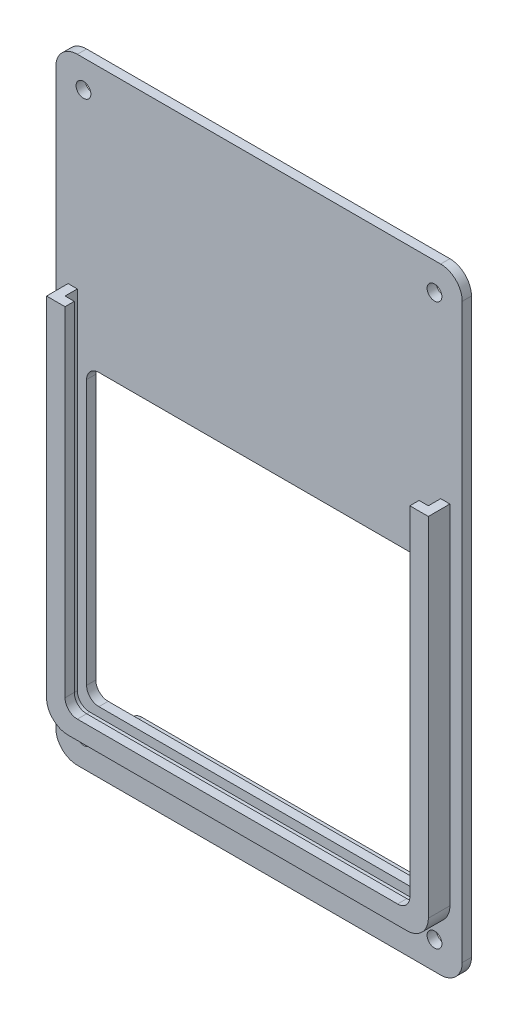
from build123d import *

# Parameters (mm, degrees)
SKETCH_1_W          = 66
SKETCH_1_H          = 100
EXTRUDE_1_DEPTH     = 1.5
FILLET_1_R          = 3.5
SKETCH_2_W          = 56
SKETCH_2_H          = 47
CUT_EXTRUDE_1_DEPTH = 1.5
FILLET_2_R          = 2
EXTRUDE_2_DEPTH     = 2
FILLET_3_R          = 2
EXTRUDE_3_DEPTH     = 1.5
FILLET_4_R          = 2
FILLET_5_R          = 3.5
SKETCH_5_W          = 48
SKETCH_5_H          = 7.5
EXTRUDE_4_DEPTH     = 1.5
FILLET_6_R          = 2
HOLE_WIZARD_M21_D   = 2.4


with BuildPart() as part:
    # Эскиз1 → Бобышка-Вытянуть1 (new body)
    with BuildSketch(Plane.XY):
        Rectangle(SKETCH_1_W, SKETCH_1_H)
    extrude(amount=EXTRUDE_1_DEPTH)

    # Скругление1
    fillet_1_edges = [part.edges().sort_by_distance(p)[0] for p in [
        (-33, -50, 0.75),
        (33, -50, 0.75),
        (33, 50, 0.75),
        (-33, 50, 0.75),
    ]]
    fillet(fillet_1_edges, radius=FILLET_1_R)

    # Эскиз2 → Вырез-Вытянуть1 (cut)
    with BuildSketch(Plane.XY.offset(1.5)):
        with Locations((0, -16.5)):
            Rectangle(SKETCH_2_W, SKETCH_2_H)
    extrude(amount=-CUT_EXTRUDE_1_DEPTH, mode=Mode.SUBTRACT)

    # Скругление2
    fillet_2_edges = [part.edges().sort_by_distance(p)[0] for p in [
        (-28, -40, 0.75),
        (28, -40, 0.75),
        (-28, 7, 0.75),
        (28, 7, 0.75),
    ]]
    fillet(fillet_2_edges, radius=FILLET_2_R)

    # Эскиз3 → Бобышка-Вытянуть2 (add)
    with BuildSketch(Plane.XY.offset(1.5)):
        Polygon((29.5, -41.5), (-29.5, -41.5), (-29.5, 17), (-31, 17), (-31, -43), (31, -43), (31, 17), (29.5, 17), align=None)
    extrude(amount=EXTRUDE_2_DEPTH)

    # Скругление3
    fillet_3_edges = [part.edges().sort_by_distance(p)[0] for p in [
        (29.5, -41.5, 2.5),
        (-29.5, -41.5, 2.5),
    ]]
    fillet(fillet_3_edges, radius=FILLET_3_R)

    # Эскиз4 → Бобышка-Вытянуть3 (add)
    with BuildSketch(Plane.XY.offset(3.5)):
        Polygon((-31, 17), (-31, -43), (31, -43), (31, 17), (28, 17), (28, -40), (-28, -40), (-28, 17), align=None)
    extrude(amount=EXTRUDE_3_DEPTH)

    # Скругление4
    fillet_4_edges = [part.edges().sort_by_distance(p)[0] for p in [
        (-28, -40, 4.25),
        (28, -40, 4.25),
    ]]
    fillet(fillet_4_edges, radius=FILLET_4_R)

    # Скругление5
    fillet_5_edges = [part.edges().sort_by_distance(p)[0] for p in [
        (-31, -43, 3.25),
        (31, -43, 3.25),
    ]]
    fillet(fillet_5_edges, radius=FILLET_5_R)

    # Эскиз5 → Бобышка-Вытянуть4 (add)
    with BuildSketch(Plane(origin=(0, 0, 0), x_dir=(-1, 0, 0), z_dir=(0, 0, -1))):
        with Locations((0, -44.75)):
            Rectangle(SKETCH_5_W, SKETCH_5_H)
        Polygon((24, 48.5), (-24, 48.5), (-24, 41), (-31.5, 41), (-31.5, 8), (31.5, 8), (31.5, 41), (24, 41), align=None)
    extrude(amount=EXTRUDE_4_DEPTH)

    # Скругление6
    fillet_6_edges = [part.edges().sort_by_distance(p)[0] for p in [
        (24, 41, -0.75),
        (24, 48.5, -0.75),
        (31.5, 41, -0.75),
        (31.5, 8, -0.75),
        (-31.5, 8, -0.75),
        (-31.5, 41, -0.75),
        (-24, 41, -0.75),
        (-24, 48.5, -0.75),
        (-24, -48.5, -0.75),
        (-24, -41, -0.75),
        (24, -41, -0.75),
        (24, -48.5, -0.75),
    ]]
    fillet(fillet_6_edges, radius=FILLET_6_R)

    # Отверстие с зазором M21 (through all)
    with Locations(Plane.XY.offset(1.5)):
        with Locations((-28.5, 45.5), (28.5, 45.5), (28.5, -45.5), (-28.5, -45.5)):
            Hole(HOLE_WIZARD_M21_D / 2)


solid = part.part
